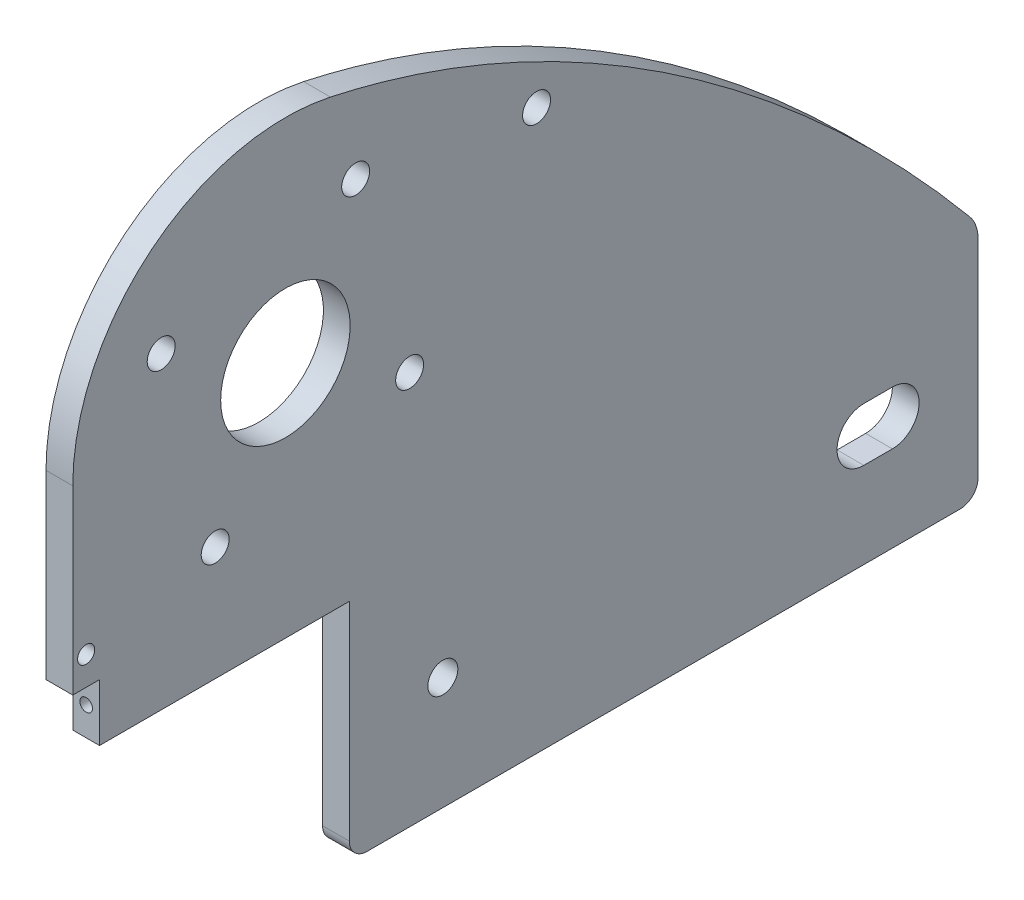
from build123d import *

# Parameters (mm, degrees)
SKETCH1_R           = 2.4892
SKETCH1_R_2         = 2.667
SKETCH1_R_3         = 1.524
SKETCH1_R_4         = 11.522750336
BOSS_EXTRUDE1_DEPTH = 4.7625
SKETCH2_R           = 1.1303
CUT_EXTRUDE1_DEPTH  = 6.35


with BuildPart() as part:
    # Sketch1 → Boss-Extrude1 (new body)
    with BuildSketch(Plane(origin=(0, 0, 0), x_dir=(0, 0, -1), z_dir=(1, 0, 0))):
        with BuildLine():
            Line((-28.170295117, 0), (77.382795117, 0))
            ThreePointArc((77.382795117, 0), (79.627859148, 0.92993597), (80.557795117, 3.175))
            Line((80.557795117, 3.175), (80.557795117, 40.132))
            ThreePointArc((80.557795117, 40.132), (80.179263316, 42.291645237), (79.088797464, 44.193811922))
            add(Edge.make_bspline(
                [(79.088797464, 44.193811922), (50.66748195, 78.347167709), (10.80796538, 109.687612786), (-34.696393838, 119.542430976)],
                knots=[0, 0, 0, 0, 1, 1, 1, 1], degree=3))
            ThreePointArc((-34.696393838, 119.542430976), (-66.471117292, 112.010601135), (-80.557795117, 82.55))
            Line((-80.557795117, 82.55), (-80.557795117, 50.292))
            Line((-80.557795117, 50.292), (-75.795295117, 50.292))
            Line((-75.795295117, 50.292), (-75.795295117, 40.132))
            Line((-75.795295117, 40.132), (-31.345295117, 40.132))
            Line((-31.345295117, 40.132), (-31.345295117, 3.175))
            ThreePointArc((-31.345295117, 3.175), (-30.415359148, 0.92993597), (-28.170295117, 0))
        make_face()
        with Locations((-55.209041359, 60.43939525)):
            Circle(SKETCH1_R, mode=Mode.SUBTRACT)
        with Locations((-14.692204883, 20.066)):
            Circle(SKETCH1_R_2, mode=Mode.SUBTRACT)
        with Locations((-20.597190367, 70.048753759)):
            Circle(SKETCH1_R, mode=Mode.SUBTRACT)
        with Locations((-64.818399868, 95.051246241)):
            Circle(SKETCH1_R, mode=Mode.SUBTRACT)
        with Locations((-30.206548876, 104.66060475)):
            Circle(SKETCH1_R, mode=Mode.SUBTRACT)
        with Locations((-78.176545117, 55.372)):
            Circle(SKETCH1_R_3, mode=Mode.SUBTRACT)
        with Locations((-42.707795117, 82.55)):
            Circle(SKETCH1_R_4, mode=Mode.SUBTRACT)
        with Locations((1.992204883, 99.566970522)):
            Circle(SKETCH1_R, mode=Mode.SUBTRACT)
        with BuildLine():
            Line((65.317795117, 15.3035), (60.237795117, 15.3035))
            ThreePointArc((60.237795117, 15.3035), (55.475295117, 20.066), (60.237795117, 24.8285))
            Line((60.237795117, 24.8285), (65.317795117, 24.8285))
            ThreePointArc((65.317795117, 24.8285), (70.080295117, 20.066), (65.317795117, 15.3035))
        make_face(mode=Mode.SUBTRACT)
    extrude(amount=BOSS_EXTRUDE1_DEPTH)

    # Sketch2 → Cut-Extrude1 (cut)
    with BuildSketch(Plane.XY.offset(75.795295117)):
        with Locations((2.38125, 45.212)):
            Circle(SKETCH2_R)
    extrude(amount=-CUT_EXTRUDE1_DEPTH, mode=Mode.SUBTRACT)


solid = part.part
